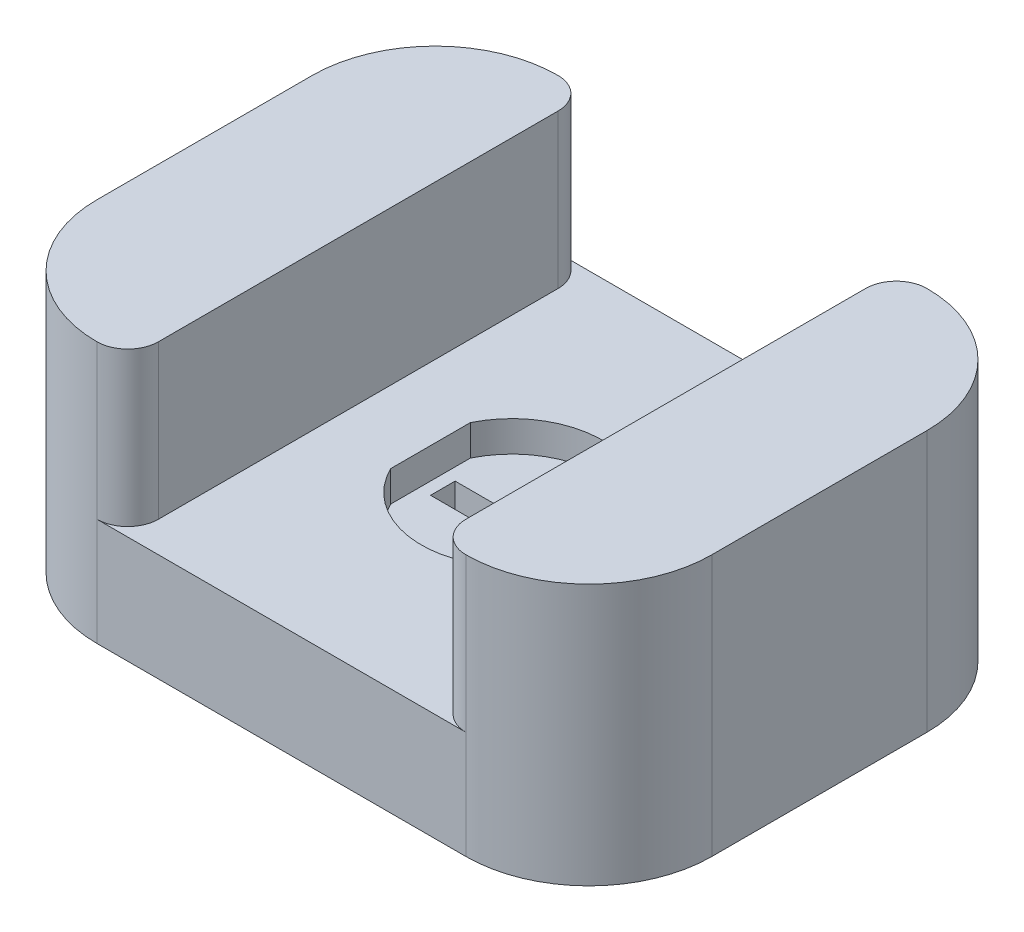
from build123d import *

# Parameters (mm, degrees)
SKETCH1_W           = 20
SKETCH1_H           = 15
BOSS_EXTRUDE1_DEPTH = 3.5
CUT_EXTRUDE1_DEPTH  = 1
CUT_EXTRUDE2_REACH  = 14.748
SKETCH3_W           = 4.5
SKETCH3_H           = 0.8
FILLET1_R           = 4
SKETCH4_W           = 4.5
SKETCH4_H           = 7.1
CUT_EXTRUDE3_DEPTH  = 0.4
FILLET2_R           = 1
BOSS_EXTRUDE2_START = 5
BOSS_EXTRUDE2_DEPTH = 5
FILLET3_R           = 1


with BuildPart() as part:
    # Sketch1 → Boss-Extrude1 (new body)
    with BuildSketch(Plane(origin=(0, 0, 0), x_dir=(1, 0, 0), z_dir=(0, 1, 0))):
        Rectangle(SKETCH1_W, SKETCH1_H)
    extrude(amount=BOSS_EXTRUDE1_DEPTH)

    # Sketch2 → Cut-Extrude1 (cut)
    with BuildSketch(Plane(origin=(0, 3.5, 0), x_dir=(1, 0, 0), z_dir=(0, 1, 0))):
        with BuildLine():
            Line((-2.65, -1.29614814), (-2.65, 1.29614814))
            ThreePointArc((-2.65, 1.29614814), (2.95, 0), (-2.65, -1.29614814))
        make_face()
    extrude(amount=-CUT_EXTRUDE1_DEPTH, mode=Mode.SUBTRACT)

    # Sketch3 → Cut-Extrude2 (cut, up to next)
    with BuildSketch(Plane(origin=(0, 2.5, 0), x_dir=(1, 0, 0), z_dir=(0, 1, 0)), mode=Mode.PRIVATE) as cut_extrude2_sk1:
        Rectangle(SKETCH3_W, SKETCH3_H)
    cut_extrude2_tool1 = extrude(cut_extrude2_sk1.sketch, amount=-CUT_EXTRUDE2_REACH, mode=Mode.PRIVATE) & part.part
    add(cut_extrude2_tool1.solids().sort_by_distance((0, 2.5, 0))[0], mode=Mode.SUBTRACT)

    # Fillet1
    fillet1_edges = [part.edges().sort_by_distance(p)[0] for p in [
        (-10, 1.75, -7.5),
        (10, 1.75, -7.5),
        (10, 1.75, 7.5),
        (-10, 1.75, 7.5),
    ]]
    fillet(fillet1_edges, radius=FILLET1_R)

    # Sketch4 → Cut-Extrude3 (cut)
    with BuildSketch(Plane.XZ):
        with Locations((0, -3.95)):
            Rectangle(SKETCH4_W, SKETCH4_H)
    extrude(amount=-CUT_EXTRUDE3_DEPTH, mode=Mode.SUBTRACT)

    # Fillet2
    fillet2_edges = [part.edges().sort_by_distance(p)[0] for p in [
        (0, 0.4, -0.4),
    ]]
    fillet(fillet2_edges, radius=FILLET2_R)

    # Sketch5 → Boss-Extrude2 (add)
    with BuildSketch(Plane(origin=(0, 3.5, 0), x_dir=(1, 0, 0), z_dir=(0, 1, 0)).offset(BOSS_EXTRUDE2_START)):
        with BuildLine():
            Line((-5, 7.5), (-5, -7.5))
            Line((-5, -7.5), (-6, -7.5))
            ThreePointArc((-6, -7.5), (-8.828427125, -6.328427125), (-10, -3.5))
            Line((-10, -3.5), (-10, 3.5))
            ThreePointArc((-10, 3.5), (-8.828427125, 6.328427125), (-6, 7.5))
            Line((-6, 7.5), (-5, 7.5))
        make_face()
        with BuildLine():
            Line((5, 7.5), (5, -7.5))
            Line((5, -7.5), (6, -7.5))
            ThreePointArc((6, -7.5), (8.828427125, -6.328427125), (10, -3.5))
            Line((10, -3.5), (10, 3.5))
            ThreePointArc((10, 3.5), (8.828427125, 6.328427125), (6, 7.5))
            Line((6, 7.5), (5, 7.5))
        make_face()
    extrude(amount=-BOSS_EXTRUDE2_DEPTH)

    # Fillet3
    fillet3_edges = [part.edges().sort_by_distance(p)[0] for p in [
        (5, 6, -7.5),
        (5, 6, 7.5),
        (-5, 6, -7.5),
        (-5, 6, 7.5),
    ]]
    fillet(fillet3_edges, radius=FILLET3_R - 0.0001)  # a hair under: the kernel refuses the full size


solid = part.part
